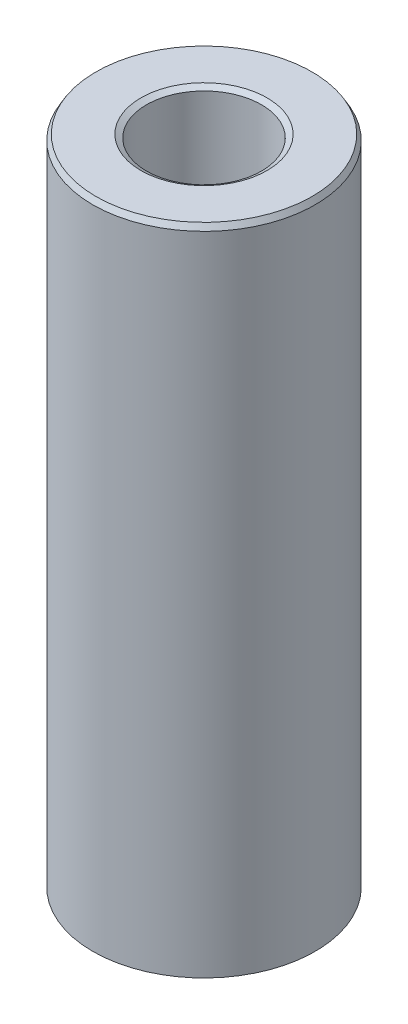
from build123d import *
from OCP.BRepFilletAPI import BRepFilletAPI_MakeChamfer

# Parameters (mm, degrees)
SKETCH1_R           = 52.5
BOSS_EXTRUDE1_DEPTH = 309.367168125
SKETCH2_R           = 27.144925283
CUT_EXTRUDE1_DEPTH  = 319.151763651
CHAMFER1_SIZE       = 2.619450771
CHAMFER1_SIZE2      = 1.512340608


with BuildPart() as part:
    # Sketch1 → Boss-Extrude1 (new body)
    with BuildSketch(Plane(origin=(0, 0, 0), x_dir=(1, 0, 0), z_dir=(0, 1, 0))):
        Circle(SKETCH1_R)
    extrude(amount=BOSS_EXTRUDE1_DEPTH)

    # Sketch2 → Cut-Extrude1 (cut, through all)
    with BuildSketch(Plane(origin=(0, 0, 0), x_dir=(1, 0, 0), z_dir=(0, 1, 0))):
        Circle(SKETCH2_R)
    extrude(amount=CUT_EXTRUDE1_DEPTH, mode=Mode.SUBTRACT)

    # Chamfer1: one chamfer whose edges measure the first distance from different faces: ONE call of the kernel's chamfer builder (chamfer() names one face for all edges)
    chamfer1_edges_1 = [part.edges().sort_by_distance(p)[0] for p in [
        (-27.144925283, 309.367168125, 0),
    ]]
    chamfer1_side_1 = [part.faces().sort_by_distance(p)[0] for p in [
        (-51.01507576, 309.367168125, 0),
    ]]
    chamfer1_edges_2 = [part.edges().sort_by_distance(p)[0] for p in [
        (-27.144925283, 0, 0),
    ]]
    chamfer1_side_2 = [part.faces().sort_by_distance(p)[0] for p in [
        (-27.144925283, 154.683584063, 0),
    ]]
    chamfer1_edges_3 = [part.edges().sort_by_distance(p)[0] for p in [
        (-52.5, 0, 0),
    ]]
    chamfer1_side_3 = [part.faces().sort_by_distance(p)[0] for p in [
        (-51.01507576, 0, 0),
    ]]
    chamfer1_edges_4 = [part.edges().sort_by_distance(p)[0] for p in [
        (-52.5, 309.367168125, 0),
    ]]
    chamfer1_side_4 = [part.faces().sort_by_distance(p)[0] for p in [
        (-52.5, 154.683584063, 0),
    ]]
    chamfer1 = BRepFilletAPI_MakeChamfer(part.part.solid().wrapped)
    for e in chamfer1_edges_1:
        chamfer1.Add(CHAMFER1_SIZE, CHAMFER1_SIZE2, e.wrapped, chamfer1_side_1[0].wrapped)  # the first distance lies on this face
    for e in chamfer1_edges_2:
        chamfer1.Add(CHAMFER1_SIZE, CHAMFER1_SIZE2, e.wrapped, chamfer1_side_2[0].wrapped)  # the first distance lies on this face
    for e in chamfer1_edges_3:
        chamfer1.Add(CHAMFER1_SIZE, CHAMFER1_SIZE2, e.wrapped, chamfer1_side_3[0].wrapped)  # the first distance lies on this face
    for e in chamfer1_edges_4:
        chamfer1.Add(CHAMFER1_SIZE, CHAMFER1_SIZE2, e.wrapped, chamfer1_side_4[0].wrapped)  # the first distance lies on this face
    add(Compound.cast(chamfer1.Shape()), mode=Mode.REPLACE)


solid = part.part
